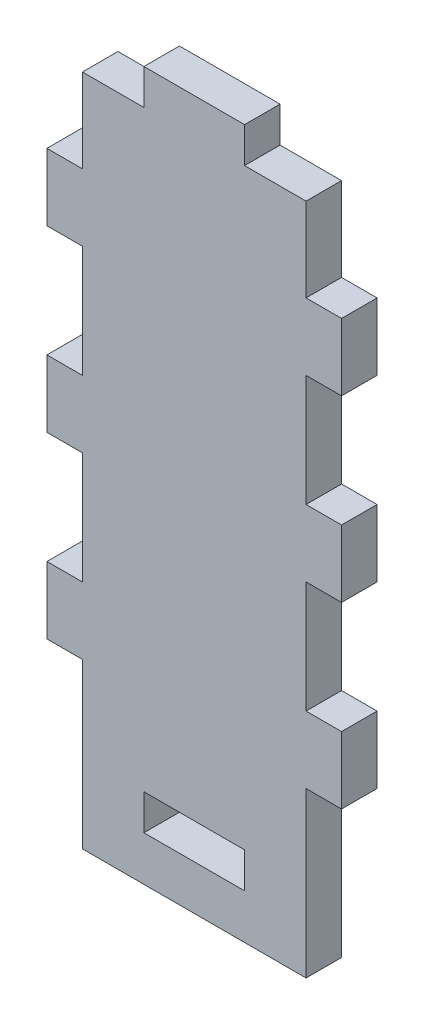
from build123d import *

# Parameters (mm, degrees)
BOSS_EXTRUDE2_DEPTH = 1.5875


with BuildPart() as part:
    # Sketch1 → Boss-Extrude2 (new, symmetric)
    with BuildSketch(Plane.XY):
        Polygon((0, 7.175), (0, 14.675), (3.175, 14.675), (3.175, 20.675), (0, 20.675), (0, 30.675), (3.175, 30.675), (3.175, 36.675), (0, 36.675), (0, 46.675), (3.175, 46.675), (3.175, 52.675), (0, 52.675), (0, 60.175), (-5.5, 60.175), (-5.5, 63.35), (-14.5, 63.35), (-14.5, 60.175), (-20, 60.175), (-20, 52.675), (-23.175, 52.675), (-23.175, 46.675), (-20, 46.675), (-20, 36.675), (-23.175, 36.675), (-23.175, 30.675), (-20, 30.675), (-20, 20.675), (-23.175, 20.675), (-23.175, 14.675), (-20, 14.675), (-20, 7.175), (-20, 0), (-10, 0), (0, 0), align=None)
        Polygon((-5.5, 4), (-10, 4), (-14.5, 4), (-14.5, 7.175), (-5.5, 7.175), align=None, mode=Mode.SUBTRACT)
    extrude(amount=BOSS_EXTRUDE2_DEPTH, both=True)


solid = part.part
